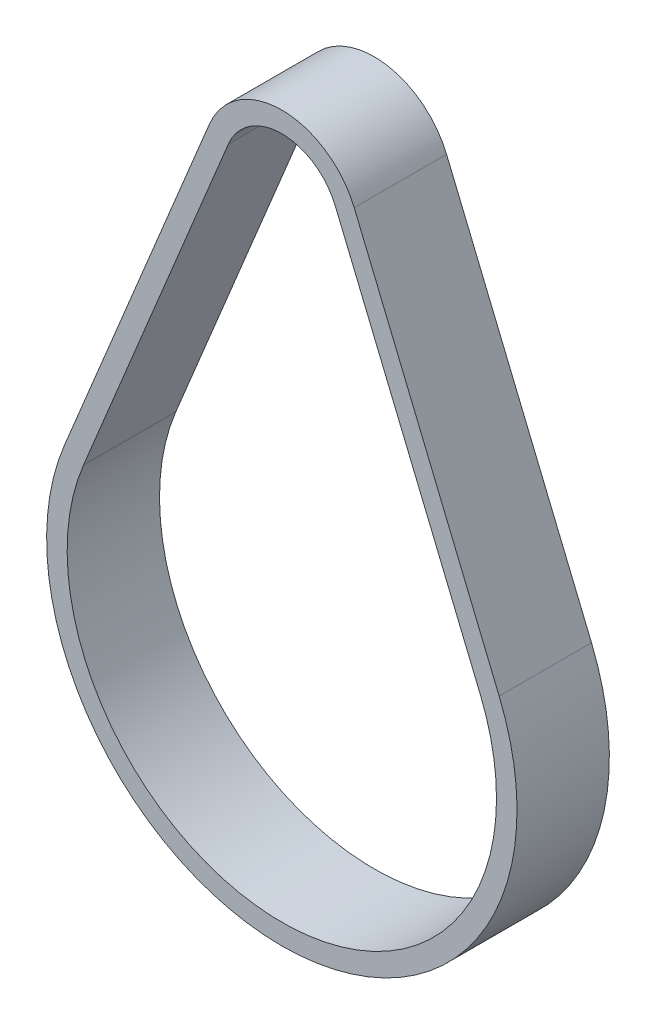
from build123d import *

# Parameters (mm, degrees)
EXTRUDE_THIN1_DEPTH = 4.5


with BuildPart() as part:
    # Sketch1 → Extrude-Thin1 (new, symmetric)
    with BuildSketch(Plane.XY):
        with BuildLine():
            Line((21.180615986, -31.241695), (7.055584775, 2.917524375))
            ThreePointArc((7.055584775, 2.917524375), (0, 7.635), (-7.055584775, 2.917524375))
            Line((-7.055584775, 2.917524375), (-21.180615986, -31.241695))
            ThreePointArc((-21.180615986, -31.241695), (0, -62.92), (21.180615986, -31.241695))
        make_face()
        with BuildLine():
            Line((19.332394695, -32.005945), (5.207363485, 2.153274375))
            ThreePointArc((5.207363485, 2.153274375), (0, 5.635), (-5.207363485, 2.153274375))
            Line((-5.207363485, 2.153274375), (-19.332394695, -32.005945))
            ThreePointArc((-19.332394695, -32.005945), (0, -60.92), (19.332394695, -32.005945))
        make_face(mode=Mode.SUBTRACT)
    extrude(amount=EXTRUDE_THIN1_DEPTH, both=True)


solid = part.part
